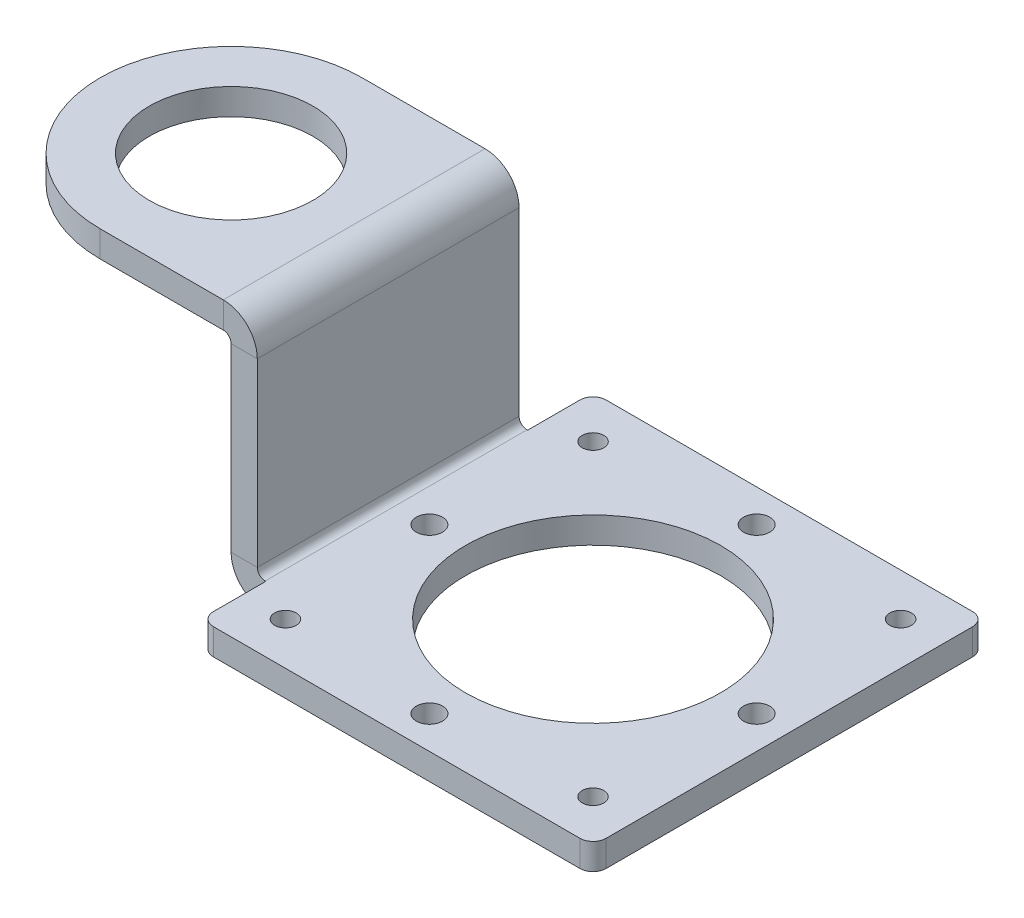
from build123d import *

# Parameters (mm, degrees)
SKETCH_1_W                       = 60
SKETCH_1_H                       = 60
SKETCH_1_R                       = 1.65
SKETCH_1_R_2                     = 19.5
SKETCH_1_R_3                     = 2
SM_BASE_FLANGE_1_DEPTH           = 4
SKETCH_4_W                       = 40
SKETCH_4_H                       = 4
EXTRUDE_1_DEPTH                  = 0.1
SM_EDGE_FLANGE_1_DEPTH           = 40
SM_EDGE_FLANGE_2_STRIP_W         = 18.4
SM_EDGE_FLANGE_2_STRIP_H         = 4
SM_EDGE_FLANGE_2_STRIP_CUT_DEPTH = 40
SM_EDGE_FLANGE_2_DEPTH           = 40
FILLET_1_R                       = 2
SKETCH_11_R                      = 12.5
CUT_EXTRUDE_1_DEPTH              = 10
FILLET_2_R                       = 20


# Sheet-metal steps are written as plain solids
with BuildPart() as part:
    # Sketch 1 → Базовая кромка1 (new body)
    with BuildSketch(Plane(origin=(0, 0, 0), x_dir=(1, 0, 0), z_dir=(0, 1, 0))):
        with Locations((-9.094903125, 3.781032797)):
            Rectangle(SKETCH_1_W, SKETCH_1_H)
        with Locations(Location((-32.594903125, 27.281032797, 0), (0, 0, 270))):
            Circle(SKETCH_1_R, mode=Mode.SUBTRACT)
        with Locations(Location((14.405096875, 27.281032797, 0), (0, 0, 270))):
            Circle(SKETCH_1_R, mode=Mode.SUBTRACT)
        with Locations(Location((-32.594903125, -19.718967203, 0), (0, 0, 270))):
            Circle(SKETCH_1_R, mode=Mode.SUBTRACT)
        with Locations(Location((14.405096875, -19.718967203, 0), (0, 0, 270))):
            Circle(SKETCH_1_R, mode=Mode.SUBTRACT)
        with Locations(Location((-9.094903125, 3.781032797, 0), (0, 0, 270))):
            Circle(SKETCH_1_R_2, mode=Mode.SUBTRACT)
        with Locations(Location((-34.094903125, 3.781032797, 0), (0, 0, 270))):
            Circle(SKETCH_1_R_3, mode=Mode.SUBTRACT)
        with Locations(Location((15.905096875, 3.781032797, 0), (0, 0, 270))):
            Circle(SKETCH_1_R_3, mode=Mode.SUBTRACT)
        with Locations(Location((-9.094903125, 28.781032797, 0), (0, 0, 270))):
            Circle(SKETCH_1_R_3, mode=Mode.SUBTRACT)
        with Locations(Location((-9.094903125, -21.218967203, 0), (0, 0, 270))):
            Circle(SKETCH_1_R_3, mode=Mode.SUBTRACT)
    extrude(amount=-SM_BASE_FLANGE_1_DEPTH)

    # Эскиз4 → Бобышка-Вытянуть1 (add)
    with BuildSketch(Plane.ZY.offset(39.094903125)):
        with Locations((-3.781032797, -2)):
            Rectangle(SKETCH_4_W, SKETCH_4_H)
    extrude(amount=EXTRUDE_1_DEPTH)

    # Ребро-кромка1 section (across the edge) → Ребро-кромка1 (add)
    with BuildSketch(Plane(origin=(-40.394903125, 0, -23.781032797), x_dir=(1, 0, 0), z_dir=(0, 0, 1))):
        with BuildLine():
            Line((-4, 1.2), (-4, 30))
            Line((-4, 30), (0, 30))
            Line((0, 30), (0, 1.2))
            ThreePointArc((0, 1.2), (0.351471863, 0.351471863), (1.2, 0))
            Line((1.2, 0), (1.2, -4))
            ThreePointArc((1.2, -4), (-2.476955262, -2.476955262), (-4, 1.2))
        make_face()
    extrude(amount=SM_EDGE_FLANGE_1_DEPTH)

    # Ребро-кромка2 strip (across the edge) → Ребро-кромка2 strip cut (cut)
    with BuildSketch(Plane(origin=(-44.394903125, 30, 16.218967203), x_dir=(0, -1, 0), z_dir=(0, 0, -1))):
        with Locations((-8, -2)):
            Rectangle(SM_EDGE_FLANGE_2_STRIP_W, SM_EDGE_FLANGE_2_STRIP_H)
    extrude(amount=SM_EDGE_FLANGE_2_STRIP_CUT_DEPTH, mode=Mode.SUBTRACT)

    # Ребро-кромка2 section (across the edge) → Ребро-кромка2 (add)
    with BuildSketch(Plane(origin=(-44.394903125, 30, 16.218967203), x_dir=(0, -1, 0), z_dir=(0, 0, -1))):
        with BuildLine():
            Line((-4, 1.2), (-4, 40))
            Line((-4, 40), (0, 40))
            Line((0, 40), (0, 1.2))
            ThreePointArc((0, 1.2), (0.351471863, 0.351471863), (1.2, 0))
            Line((1.2, 0), (1.2, -4))
            ThreePointArc((1.2, -4), (-2.476955262, -2.476955262), (-4, 1.2))
        make_face()
    extrude(amount=SM_EDGE_FLANGE_2_DEPTH)

    # Скругление1
    fillet_1_edges = [part.edges().sort_by_distance(p)[0] for p in [
        (-39.094903125, -2, -33.781032797),
        (20.905096875, -2, -33.781032797),
        (20.905096875, -2, 26.218967203),
        (-39.094903125, -2, 26.218967203),
    ]]
    fillet(fillet_1_edges, radius=FILLET_1_R)

    # Эскиз11 → Вырез-Вытянуть1 (cut)
    with BuildSketch(Plane(origin=(0, 34, 0), x_dir=(1, 0, 0), z_dir=(0, 1, 0))):
        with Locations(Location((-64.394903125, 3.781032797, 0), (0, 0, 270))):
            Circle(SKETCH_11_R)
    extrude(amount=-CUT_EXTRUDE_1_DEPTH, mode=Mode.SUBTRACT)

    # Скругление2
    fillet_2_edges = [part.edges().sort_by_distance(p)[0] for p in [
        (-84.394903125, 32, -23.781032797),
        (-84.394903125, 32, 16.218967203),
    ]]
    fillet(fillet_2_edges, radius=FILLET_2_R - 0.0001)  # a hair under: the kernel refuses the full size


solid = part.part
